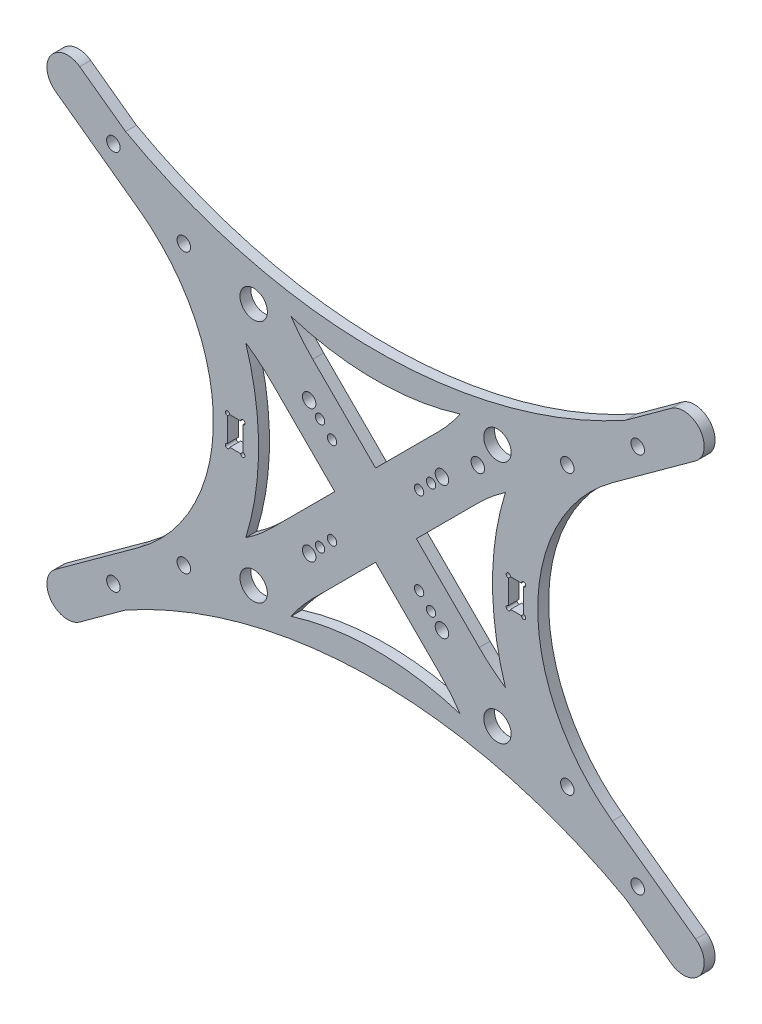
from build123d import *

# Parameters (mm, degrees)
SKETCH_7_R             = 1.075
SKETCH_7_R_2           = 1.55
SKETCH_7_R_3           = 3.15
SKETCH_7_R_4           = 3.150000003
EXTRUDE_2_5_DEPTH      = 2.5
CUT_EXTRUDE_2_DEPTH    = 95.113928094
SKETCH_8_W             = 3.5
SKETCH_8_H             = 6.5
CUT_EXTRUDE_3_DEPTH    = 95.113928094
PCB_2_R                = 1.55
PCB_DEPTH              = 95.113928094
SKETCH_9_R             = 0.5
CUT_EXTRUDE_4383_DEPTH = 95.113928094


with BuildPart() as part:
    # 草图7 → 主结构-厚度还是得2.5, 不然铝柱不好选 (new body)
    with BuildSketch(Plane.XY):
        with BuildLine():
            Line((-67.948496874, -55.238795586), (-57.42060576, -47.589834961))
            ThreePointArc((-57.42060576, -47.589834961), (0, -32.757979874), (57.42060576, -47.589834961))
            Line((57.42060576, -47.589834961), (67.948496874, -55.238795586))
            ThreePointArc((67.948496874, -55.238795586), (74.583307546, -54.187944811), (73.532456771, -47.55313414))
            Line((73.532456771, -47.55313414), (54.395000648, -33.648958388))
            ThreePointArc((54.395000648, -33.648958388), (37.25, 0), (54.395000648, 33.648958388))
            Line((54.395000648, 33.648958388), (73.532456771, 47.55313414))
            ThreePointArc((73.532456771, 47.55313414), (74.583307546, 54.187944811), (67.948496874, 55.238795586))
            Line((67.948496874, 55.238795586), (57.42060576, 47.589834961))
            ThreePointArc((57.42060576, 47.589834961), (0, 32.757979874), (-57.42060576, 47.589834961))
            Line((-57.42060576, 47.589834961), (-67.948496874, 55.238795586))
            ThreePointArc((-67.948496874, 55.238795586), (-74.583307546, 54.187944811), (-73.532456771, 47.55313414))
            Line((-73.532456771, 47.55313414), (-54.395000648, 33.648958388))
            ThreePointArc((-54.395000648, 33.648958388), (-37.25, 0), (-54.395000648, -33.648958388))
            Line((-54.395000648, -33.648958388), (-73.532456771, -47.55313414))
            ThreePointArc((-73.532456771, -47.55313414), (-74.583307546, -54.187944811), (-67.948496874, -55.238795586))
        make_face()
        with Locations((10, 10)):
            Circle(SKETCH_7_R, mode=Mode.SUBTRACT)
        with Locations((12.75, 12.75)):
            Circle(SKETCH_7_R, mode=Mode.SUBTRACT)
        with Locations((15.25, 15.25)):
            Circle(SKETCH_7_R_2, mode=Mode.SUBTRACT)
        with Locations((15.25, -15.25)):
            Circle(SKETCH_7_R_2, mode=Mode.SUBTRACT)
        with Locations((12.75, -12.75)):
            Circle(SKETCH_7_R, mode=Mode.SUBTRACT)
        with Locations((10, -10)):
            Circle(SKETCH_7_R, mode=Mode.SUBTRACT)
        with Locations((28, -28)):
            Circle(SKETCH_7_R_3, mode=Mode.SUBTRACT)
        with Locations((28, 28)):
            Circle(SKETCH_7_R_4, mode=Mode.SUBTRACT)
        with Locations((60.224561343, 43.755705046)):
            Circle(SKETCH_7_R_2, mode=Mode.SUBTRACT)
        with Locations((-60.224561343, 43.755705046)):
            Circle(SKETCH_7_R_2, mode=Mode.SUBTRACT)
        with Locations((-28, 28)):
            Circle(SKETCH_7_R_4, mode=Mode.SUBTRACT)
        with Locations((-28, -28)):
            Circle(SKETCH_7_R_3, mode=Mode.SUBTRACT)
        with Locations((-10, -10)):
            Circle(SKETCH_7_R, mode=Mode.SUBTRACT)
        with Locations((-12.75, -12.75)):
            Circle(SKETCH_7_R, mode=Mode.SUBTRACT)
        with Locations((-15.25, -15.25)):
            Circle(SKETCH_7_R_2, mode=Mode.SUBTRACT)
        with Locations((-15.25, 15.25)):
            Circle(SKETCH_7_R_2, mode=Mode.SUBTRACT)
        with Locations((-12.75, 12.75)):
            Circle(SKETCH_7_R, mode=Mode.SUBTRACT)
        with Locations((-10, 10)):
            Circle(SKETCH_7_R, mode=Mode.SUBTRACT)
        with Locations((60.224561343, -43.755705046)):
            Circle(SKETCH_7_R_2, mode=Mode.SUBTRACT)
        with Locations((44.044221455, -32)):
            Circle(SKETCH_7_R_2, mode=Mode.SUBTRACT)
        with Locations((44.044221455, 32)):
            Circle(SKETCH_7_R_2, mode=Mode.SUBTRACT)
        with Locations((-44.044221455, 32)):
            Circle(SKETCH_7_R_2, mode=Mode.SUBTRACT)
        with Locations((-60.224561343, -43.755705046)):
            Circle(SKETCH_7_R_2, mode=Mode.SUBTRACT)
        with Locations((-44.044221455, -32)):
            Circle(SKETCH_7_R_2, mode=Mode.SUBTRACT)
    extrude(amount=EXTRUDE_2_5_DEPTH)

    # 草图6 → 切除-拉伸2 (cut, through all)
    with BuildSketch(Plane.XY):
        with BuildLine():
            Line((-23.801448899, 14.429581723), (-9.371867176, 0))
            Line((-9.371867176, 0), (-23.801448899, -14.429581723))
            ThreePointArc((-23.801448899, -14.429581723), (-26.692624222, -17.058284994), (-29.820182402, -19.400795498))
            ThreePointArc((-29.820182402, -19.400795498), (-26.863678166, 0), (-29.820182402, 19.400795498))
            ThreePointArc((-29.820182402, 19.400795498), (-26.692624222, 17.058284994), (-23.801448899, 14.429581723))
        make_face()
        with BuildLine():
            Line((14.429581723, 23.801448899), (0, 9.371867176))
            Line((0, 9.371867176), (-14.429581723, 23.801448899))
            ThreePointArc((-14.429581723, 23.801448899), (-17.058284994, 26.692624222), (-19.400795498, 29.820182402))
            ThreePointArc((-19.400795498, 29.820182402), (0, 26.863678166), (19.400795498, 29.820182402))
            ThreePointArc((19.400795498, 29.820182402), (17.058284994, 26.692624222), (14.429581723, 23.801448899))
        make_face()
        with BuildLine():
            Line((23.801448899, -14.429581723), (9.371867176, 0))
            Line((9.371867176, 0), (23.801448899, 14.429581723))
            ThreePointArc((23.801448899, 14.429581723), (26.692624222, 17.058284994), (29.820182402, 19.400795498))
            ThreePointArc((29.820182402, 19.400795498), (26.863678166, 0), (29.820182402, -19.400795498))
            ThreePointArc((29.820182402, -19.400795498), (26.692624222, -17.058284994), (23.801448899, -14.429581723))
        make_face()
        with BuildLine():
            Line((-14.429581723, -23.801448899), (0, -9.371867176))
            Line((0, -9.371867176), (14.429581723, -23.801448899))
            ThreePointArc((14.429581723, -23.801448899), (17.058284994, -26.692624222), (19.400795498, -29.820182402))
            ThreePointArc((19.400795498, -29.820182402), (0, -26.863678166), (-19.400795498, -29.820182402))
            ThreePointArc((-19.400795498, -29.820182402), (-17.058284994, -26.692624222), (-14.429581723, -23.801448899))
        make_face()
    extrude(amount=CUT_EXTRUDE_2_DEPTH, mode=Mode.SUBTRACT)

    # 草图8 → 切除-拉伸3 (cut, through all)
    with BuildSketch(Plane.XY):
        with Locations((32.25, 0)):
            Rectangle(SKETCH_8_W, SKETCH_8_H)
        with Locations((-32.25, 0)):
            Rectangle(SKETCH_8_W, SKETCH_8_H)
    extrude(amount=CUT_EXTRUDE_3_DEPTH, mode=Mode.SUBTRACT)

    # PCB 2 → PCB (cut, through all)
    with BuildSketch(Plane.XY):
        with Locations((23.5, 21.71275604)):
            Circle(PCB_2_R)
        with Locations((-32, 42)):
            Circle(PCB_2_R)
        with Locations((32, 42)):
            Circle(PCB_2_R)
        with Locations((-36, -43)):
            Circle(PCB_2_R)
        with Locations((36, -43)):
            Circle(PCB_2_R)
        with Locations((-29.25, -40.5)):
            Circle(PCB_2_R)
        with Locations((29.25, -40.5)):
            Circle(PCB_2_R)
        with Locations((-17.5, 47.5)):
            Circle(PCB_2_R)
        with Locations((17.5, 47.5)):
            Circle(PCB_2_R)
    extrude(amount=PCB_DEPTH, mode=Mode.SUBTRACT)

    # 草图9 → Cut-Extrude 4383 (cut, through all)
    with BuildSketch(Plane.XY.offset(2.5)):
        with Locations((-34, 3.25)):
            Circle(SKETCH_9_R)
        with Locations((-30.5, 3.25)):
            Circle(SKETCH_9_R)
        with Locations((-30.5, -3.25)):
            Circle(SKETCH_9_R)
        with Locations((-34, -3.25)):
            Circle(SKETCH_9_R)
        with Locations((34, -3.25)):
            Circle(SKETCH_9_R)
        with Locations((30.5, -3.25)):
            Circle(SKETCH_9_R)
        with Locations((30.5, 3.25)):
            Circle(SKETCH_9_R)
        with Locations((34, 3.25)):
            Circle(SKETCH_9_R)
    extrude(amount=-CUT_EXTRUDE_4383_DEPTH, mode=Mode.SUBTRACT)


solid = part.part
